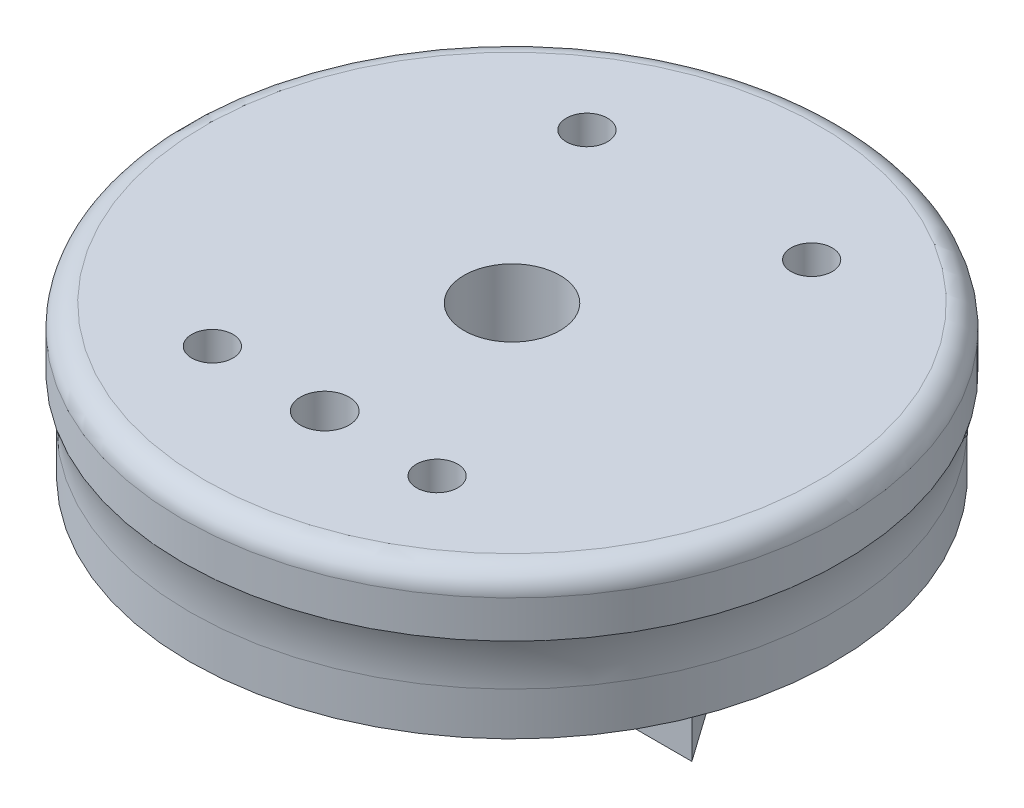
from build123d import *

# Parameters (mm, degrees)
SKETCH1_R             = 43
BOSS_EXTRUDE1_DEPTH   = 20
SKETCH2_R             = 44
BOSS_EXTRUDE2_DEPTH   = 8
FILLET1_R             = 20
BOSS_EXTRUDE3_DEPTH   = 10
SKETCH5_R             = 2.1
CUT_EXTRUDE1_DEPTH    = 4
CUT_EXTRUDE2_DEPTH    = 5
FILLET2_R             = 3
BOSS_EXTRUDE4_DEPTH   = 10
SKETCH10_R            = 2.1
CUT_EXTRUDE3_DEPTH    = 4
SKETCH11_R            = 3.25
CUT_EXTRUDE4_DEPTH    = 47
CROQUIS1_R            = 2.75
CORTAR_EXTRUIR1_DEPTH = 13
CROQUIS2_R            = 6.4
CORTAR_EXTRUIR2_DEPTH = 10


with BuildPart() as part:
    # Sketch1 → Boss-Extrude1 (new body)
    with BuildSketch(Plane(origin=(0, 0, 0), x_dir=(1, 0, 0), z_dir=(0, 1, 0))):
        with Locations(Location((0, 0, 0), (0, 0, 270))):
            Circle(SKETCH1_R)
    extrude(amount=BOSS_EXTRUDE1_DEPTH)

    # Sketch2 → Boss-Extrude2 (add)
    with BuildSketch(Plane(origin=(0, 20, 0), x_dir=(1, 0, 0), z_dir=(0, 1, 0))):
        with Locations(Location((0, 0, 0), (0, 0, 270))):
            Circle(SKETCH2_R)
    extrude(amount=-BOSS_EXTRUDE2_DEPTH)

    # Fillet1
    # the kernel refuses this fillet: 20 mm, written as the material it adds along each edge
    with BuildSketch(Plane(origin=(0, 12, 0), x_dir=(0, 0, 1), z_dir=(1, 0, 0))) as fillet1_piece_1:
        with BuildLine():
            CenterArc((63, 6.244997998), FILLET1_R, 180, 18.194872339)
            Line((44, 0), (43, 0))
            Line((43, 0), (43, 6.244997998))
        make_face()
    revolve(axis=Axis((0, 12, 0), (0, -1, 0)))

    # Sketch4 → Boss-Extrude3 (add)
    with BuildSketch(Plane.XZ):
        Polygon((28.890073358, 11), (35.011581558, 11), (0, -38.567688166), (-2.046413556, -32.798368085), align=None)
    extrude(amount=BOSS_EXTRUDE3_DEPTH)

    # Sketch5 → Cut-Extrude1 (cut)
    with BuildSketch(Plane(origin=(18.174388611, 0, -12.837275908), x_dir=(-0.576932008090494, 0, -0.8167921755505927), z_dir=(0.8167921755505927, 0, -0.576932008090494))):
        with Locations((-21.184015986, -5)):
            Circle(SKETCH5_R)
        with Locations(Location((23.501785923, -5, 0), (0, 0, 180))):
            Circle(SKETCH5_R)
    extrude(amount=-CUT_EXTRUDE1_DEPTH, mode=Mode.SUBTRACT)

    # Sketch7 → Cut-Extrude2 (cut)
    with BuildSketch(Plane.XZ):
        with BuildLine():
            Line((8.455950561, -5.839980603), (-5.151807084, 3.771706651))
            ThreePointArc((-5.151807084, 3.771706651), (-8.391785298, 4.503949914), (-11.200570041, 2.730713525))
            Line((-11.200570041, 2.730713525), (-20.812257296, -10.87704412))
            ThreePointArc((-20.812257296, -10.87704412), (-21.544500559, -14.117022334), (-19.771264169, -16.925807077))
            Line((-19.771264169, -16.925807077), (-6.163506524, -26.537494332))
            ThreePointArc((-6.163506524, -26.537494332), (-2.92352831, -27.269737595), (-0.114743567, -25.496501205))
            Line((-0.114743567, -25.496501205), (9.496943688, -11.88874356))
            ThreePointArc((9.496943688, -11.88874356), (10.22918695, -8.648765346), (8.455950561, -5.839980603))
        make_face()
    extrude(amount=-CUT_EXTRUDE2_DEPTH, mode=Mode.SUBTRACT)

    # Fillet2
    fillet2_edges = [part.edges().sort_by_distance(p)[0] for p in [
        (0, 20, -44),
    ]]
    fillet(fillet2_edges, radius=FILLET2_R)

    # Sketch8 → Boss-Extrude4 (add)
    with BuildSketch(Plane.XZ):
        Polygon((28.890073358, 11), (-35.011581558, 11), (-31.47988754, 6), (25.35837934, 6), align=None)
    extrude(amount=BOSS_EXTRUDE4_DEPTH)

    # Sketch10 → Cut-Extrude3 (cut)
    with BuildSketch(Plane.XY.offset(11)):
        with Locations((-17.011581558, -5)):
            Circle(SKETCH10_R)
        with Locations((17.011581558, -5)):
            Circle(SKETCH10_R)
    extrude(amount=-CUT_EXTRUDE3_DEPTH, mode=Mode.SUBTRACT)

    # Sketch11 → Cut-Extrude4 (cut)
    with BuildSketch(Plane.XZ):
        with Locations(Location((0, 25, 0), (0, 0, 270))):
            Circle(SKETCH11_R)
    extrude(amount=-CUT_EXTRUDE4_DEPTH, mode=Mode.SUBTRACT)

    # Croquis1 → Cortar-Extruir1 (cut)
    with BuildSketch(Plane(origin=(0, 20, 0), x_dir=(1, 0, 0), z_dir=(0, 1, 0))):
        with Locations(Location((-15, 25, 0), (0, 0, 270))):
            Circle(CROQUIS1_R)
        with Locations(Location((15, 25, 0), (0, 0, 270))):
            Circle(CROQUIS1_R)
        with Locations(Location((15, -25, 0), (0, 0, 270))):
            Circle(CROQUIS1_R)
        with Locations(Location((-15, -25, 0), (0, 0, 270))):
            Circle(CROQUIS1_R)
    extrude(amount=-CORTAR_EXTRUIR1_DEPTH, mode=Mode.SUBTRACT)

    # Croquis2 → Cortar-Extruir2 (cut)
    with BuildSketch(Plane(origin=(0, 20, 0), x_dir=(1, 0, 0), z_dir=(0, 1, 0))):
        with Locations(Location((0, 0, 0), (0, 0, 270))):
            Circle(CROQUIS2_R)
    extrude(amount=-CORTAR_EXTRUIR2_DEPTH, mode=Mode.SUBTRACT)


solid = part.part
